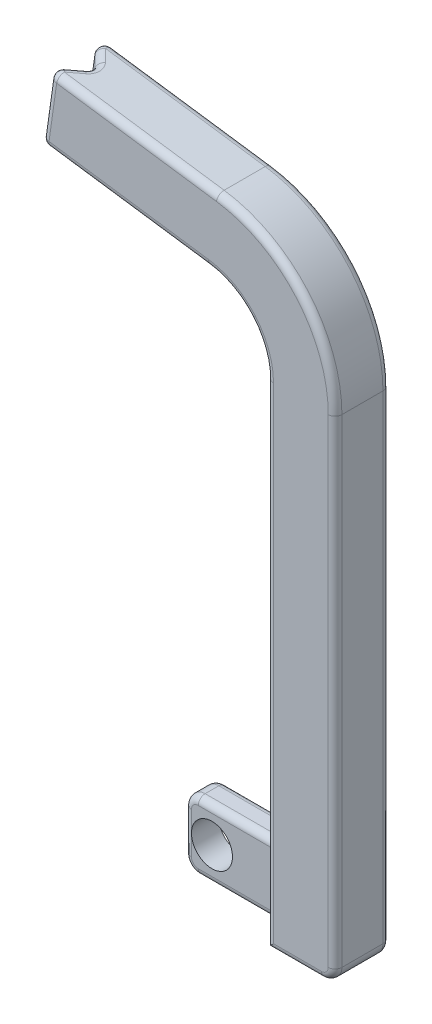
from build123d import *

# Parameters (mm, degrees)
EXTRUDE_1_DEPTH     = 2
EXTRUDE_2_DEPTH     = 2
CUT_EXTRUDE_1_DEPTH = 5
SKETCH_4_R          = 1.5
CUT_EXTRUDE_2_DEPTH = 48.894743495
FILLET_1_R          = 0.5


with BuildPart() as part:
    # 草图1 → 凸台-拉伸1 (new body)
    with BuildSketch(Plane.XY):
        with BuildLine():
            Line((-5.5, 2.5), (5.5, 2.5))
            ThreePointArc((5.5, 2.5), (6.207106781, 2.207106781), (6.5, 1.5))
            Line((6.5, 1.5), (6.5, -1.5))
            ThreePointArc((6.5, -1.5), (6.207106781, -2.207106781), (5.5, -2.5))
            Line((5.5, -2.5), (-5.5, -2.5))
            ThreePointArc((-5.5, -2.5), (-6.207106781, -2.207106781), (-6.5, -1.5))
            Line((-6.5, -1.5), (-6.5, 1.5))
            ThreePointArc((-6.5, 1.5), (-6.207106781, 2.207106781), (-5.5, 2.5))
        make_face()
    extrude(amount=EXTRUDE_1_DEPTH)

    # 草图2 → 凸台-拉伸2 (add, symmetric)
    with BuildSketch(Plane.XY.offset(2)):
        with BuildLine():
            Line((6.5, 1.5), (6.5, 33.5))
            ThreePointArc((6.5, 33.5), (4.047095802, 40.06059029), (-2.10826899, 43.402680687))
            Line((-2.10826899, 43.402680687), (-14.981753884, 45.211931))
            Line((-14.981753884, 45.211931), (-15.677619389, 40.260590656))
            Line((-15.677619389, 40.260590656), (-2.804134495, 38.451340344))
            ThreePointArc((-2.804134495, 38.451340344), (0.273547901, 36.780295145), (1.5, 33.5))
            Line((1.5, 33.5), (1.5, 2.5))
            Line((1.5, 2.5), (1.5, -2.5))
            Line((1.5, -2.5), (5.5, -2.5))
            ThreePointArc((5.5, -2.5), (6.207106781, -2.207106781), (6.5, -1.5))
            Line((6.5, -1.5), (6.5, 1.5))
        make_face()
    extrude(amount=EXTRUDE_2_DEPTH, both=True)

    # 草图3 → 切除-拉伸1 (cut)
    with BuildSketch(Plane(origin=(5.940864687, 42.271448722, 0), x_dir=(0.9902680687415704, -0.13917310096006608, 0), z_dir=(0.13917310096006608, 0.9902680687415704, 0))):
        Polygon((-21.128237123, 0), (-19.126013359, -2), (-21.128237123, -4), align=None)
    extrude(amount=-CUT_EXTRUDE_1_DEPTH, mode=Mode.SUBTRACT)

    # 草图4 → 切除-拉伸2 (cut, through all)
    with BuildSketch(Plane.XY.offset(2)):
        with Locations((-4.5, 0)):
            Circle(SKETCH_4_R)
    extrude(amount=-CUT_EXTRUDE_2_DEPTH, mode=Mode.SUBTRACT)

    # 圆角1
    fillet_1_edges = [part.edges().sort_by_distance(p)[0] for p in [
        (-6.5, 0, 0),
        (-6.207106781, 2.207106781, 0),
        (-6.207106781, 2.207106781, 2),
        (-6.5, 0, 2),
        (-6.207106781, -2.207106781, 2),
        (-2, -2.5, 2),
        (-2, 2.5, 0),
        (-2, 2.5, 2),
        (1.5, 18, 0),
        (4.047095802, 40.06059029, 0),
        (-8.545011437, 44.307305844, 0),
        (-15.329686636, 42.736260828, 0),
        (-9.240876942, 39.3559655, 0),
        (0.273547901, 36.780295145, 0),
        (6.5, 16, 4),
        (4.047095802, 40.06059029, 4),
        (-8.545011437, 44.307305844, 4),
        (-15.329686636, 42.736260828, 4),
        (-9.240876942, 39.3559655, 4),
        (0.273547901, 36.780295145, 4),
        (1.5, 15.5, 4),
        (3.5, -2.5, 4),
        (6.207106781, -2.207106781, 4),
        (-13.346948377, 42.457605138, 2),
        (-13.990384754, 45.072603155, 3),
        (-13.990384754, 45.072603155, 1),
        (-14.686250259, 40.121262811, 1),
        (-14.686250259, 40.121262811, 3),
        (6.5, 16, 0),
        (6.207106781, -2.207106781, 0),
        (0, -2.5, 0),
        (-6.207106781, -2.207106781, 0),
    ]]
    fillet(fillet_1_edges, radius=FILLET_1_R - 0.0001)  # a hair under: the kernel refuses the full size


solid = part.part
